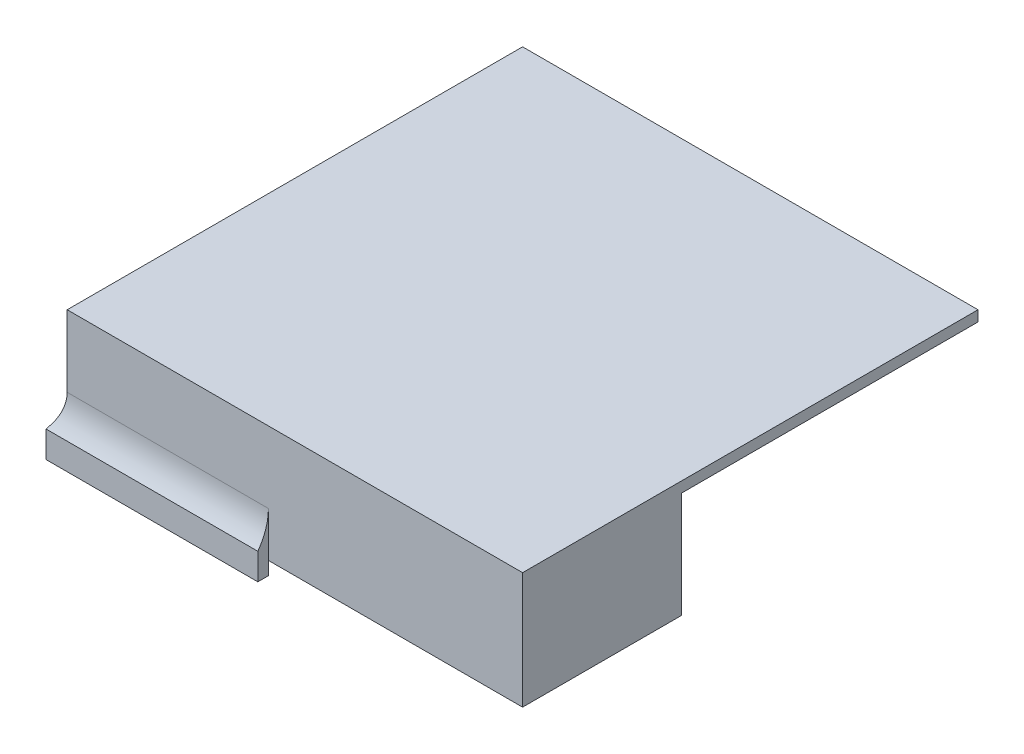
from build123d import *

# Parameters (mm, degrees)
BOSS_EXTRUDE1_DEPTH = 20
SKETCH2_W           = 86
SKETCH2_H           = 86
BOSS_EXTRUDE2_DEPTH = 2
CUT_EXTRUDE1_DEPTH  = 20
SKETCH4_W           = 2
SKETCH4_H           = 40
SKETCH4_W_2         = 40
SKETCH4_H_2         = 2
BOSS_EXTRUDE4_DEPTH = 2.5
FILLET1_R           = 10


with BuildPart() as part:
    # Sketch1 → Boss-Extrude1 (new body)
    with BuildSketch(Plane(origin=(0, 0, 0), x_dir=(1, 0, 0), z_dir=(0, 1, 0))):
        Polygon((-43, 43), (-43, -43), (14.982756057, 14.982756057), (-13.034487885, 43), align=None)
        Polygon((14.982756057, 14.982756057), (-43, -43), (43, -43), (43, -13.034487885), align=None)
    extrude(amount=BOSS_EXTRUDE1_DEPTH)

    # Sketch2 → Boss-Extrude2 (add)
    with BuildSketch(Plane(origin=(0, 20, 0), x_dir=(1, 0, 0), z_dir=(0, 1, 0))):
        Rectangle(SKETCH2_W, SKETCH2_H)
    extrude(amount=BOSS_EXTRUDE2_DEPTH)

    # Sketch3 → Cut-Extrude1 (cut)
    with BuildSketch(Plane.XZ):
        Polygon((-13.86291501, -41), (41, 13.86291501), (41, 41), (-41, 41), (-41, -41), align=None)
    extrude(amount=-CUT_EXTRUDE1_DEPTH, mode=Mode.SUBTRACT)

    # Sketch4 → Boss-Extrude4 (add, symmetric)
    with BuildSketch(Plane.XZ):
        with Locations((-44, 23)):
            Rectangle(SKETCH4_W, SKETCH4_H)
        with Locations((-25, 44)):
            Rectangle(SKETCH4_W_2, SKETCH4_H_2)
    extrude(amount=BOSS_EXTRUDE4_DEPTH, both=True)

    # Fillet1
    # the kernel refuses this fillet: 10 mm, written as the material it adds along each edge
    with BuildSketch(Plane(origin=(-43, 2.5, 3), x_dir=(0, 1, 0), z_dir=(0, 0, 1))) as fillet1_piece_1:
        with BuildLine():
            CenterArc((6, 10), FILLET1_R, 233.130102354, 36.869897646)
            Line((0, 2), (-0.12, 1.84))
            ThreePointArc((-0.12, 1.84), (-0.2, 1), (-0.2, 0))
            Line((-0.2, 0), (0, -0.2))
            Line((0, -0.2), (6, -0.2))
            Line((6, -0.2), (6, 0))
        make_face()
    extrude(amount=40)
    with BuildSketch(Plane(origin=(-5, 2.5, 43), x_dir=(0, 0, 1), z_dir=(-1, 0, 0))) as fillet1_piece_2:
        with BuildLine():
            CenterArc((10, 6), FILLET1_R, 180, 36.869897646)
            Line((0, 6), (-0.2, 6))
            Line((-0.2, 6), (-0.2, 0))
            Line((-0.2, 0), (0, -0.2))
            ThreePointArc((0, -0.2), (1, -0.2), (1.84, -0.12))
            Line((1.84, -0.12), (2, 0))
        make_face()
    extrude(amount=38)
    with BuildSketch(Plane(origin=(-43, 2.5, 3), x_dir=(0, 1, 0), z_dir=(0, 0, 1))) as fillet1_piece_3a_section:
        with BuildLine():
            CenterArc((6, 10), FILLET1_R, 233.130102354, 36.869897646)
            Line((0, 2), (-0.12, 1.84))
            ThreePointArc((-0.12, 1.84), (-0.2, 1), (-0.2, 0))
            Line((-0.2, 0), (0, -0.2))
            Line((0, -0.2), (6, -0.2))
            Line((6, -0.2), (6, 0))
        make_face()
    fillet1_piece_3a = extrude(amount=55, mode=Mode.PRIVATE)
    fillet1_piece_3a = split(fillet1_piece_3a, bisect_by=Plane(origin=(-43.452376795, 4.199345627, 43), z_dir=(0, 0, 1)), keep=Keep.TOP, mode=Mode.PRIVATE)
    fillet1_piece_3a = split(fillet1_piece_3a, bisect_by=Plane(origin=(-43.452376795, 4.199345627, 45), z_dir=(0, 0, -1)), keep=Keep.TOP, mode=Mode.PRIVATE)
    with BuildSketch(Plane(origin=(-5, 2.5, 43), x_dir=(0, 0, 1), z_dir=(-1, 0, 0))) as fillet1_piece_3b_section:
        with BuildLine():
            CenterArc((10, 6), FILLET1_R, 180, 36.869897646)
            Line((0, 6), (-0.2, 6))
            Line((-0.2, 6), (-0.2, 0))
            Line((-0.2, 0), (0, -0.2))
            ThreePointArc((0, -0.2), (1, -0.2), (1.84, -0.12))
            Line((1.84, -0.12), (2, 0))
        make_face()
    fillet1_piece_3b = extrude(amount=53, mode=Mode.PRIVATE)
    fillet1_piece_3b = split(fillet1_piece_3b, bisect_by=Plane(origin=(-43, 4.199345627, 43.452376795), z_dir=(-1, 0, 0)), keep=Keep.TOP, mode=Mode.PRIVATE)
    fillet1_piece_3b = split(fillet1_piece_3b, bisect_by=Plane(origin=(-45, 4.199345627, 43.452376795), z_dir=(1, 0, 0)), keep=Keep.TOP, mode=Mode.PRIVATE)
    fillet1_piece_3 = fillet1_piece_3a & fillet1_piece_3b
    add(fillet1_piece_3)


solid = part.part
